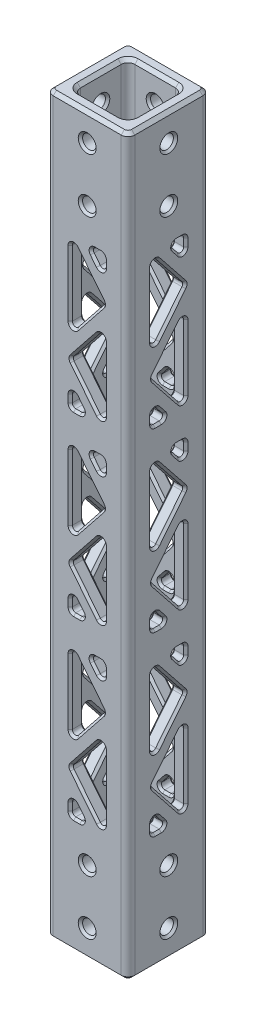
from build123d import *

# Parameters (mm, degrees)
SKETCH1_W                    = 19.05
SKETCH1_H                    = 19.05
SKETCH1_W_2                  = 12.7
SKETCH1_H_2                  = 12.7
BOSS_EXTRUDE1_DEPTH          = 85.725
F_1_8_0_125_DIAMETER_HOLE1_D = 3.175
F_1_8_0_125_DIAMETER_HOLE2_D = 3.175
F_1_8_0_125_DIAMETER_HOLE3_D = 3.175
CUT_EXTRUDE1_REACH           = 88.777
CIRPATTERN1_COUNT            = 4
FILLET1_R                    = 1.5875
FILLET2_R                    = 0.79375
CHAMFER4_SIZE                = 0.762
CHAMFER3_SIZE                = 0.508


with BuildPart() as part:
    # Sketch1 → Boss-Extrude1 (new, symmetric)
    with BuildSketch(Plane(origin=(0, 0, 0), x_dir=(1, 0, 0), z_dir=(0, 1, 0))):
        Rectangle(SKETCH1_W, SKETCH1_H)
        Rectangle(SKETCH1_W_2, SKETCH1_H_2, mode=Mode.SUBTRACT)
    extrude(amount=BOSS_EXTRUDE1_DEPTH, both=True)

    # 1/8 (0.125) Diameter Hole1 (through all)
    with Locations(Plane.ZY.offset(9.525)):
        with Locations((0, 79.375), (0, 66.675)):
            Hole(F_1_8_0_125_DIAMETER_HOLE1_D / 2)

    # 1/8 (0.125) Diameter Hole2 (through all)
    with Locations(Plane.ZY.offset(9.525)):
        with Locations((0, -66.675), (0, -79.375)):
            Hole(F_1_8_0_125_DIAMETER_HOLE2_D / 2)

    # 1/8 (0.125) Diameter Hole3 (through all)
    with Locations(Plane.XY.offset(9.525)):
        with Locations((0, 79.375), (0, 66.675), (0, -66.675), (0, -79.375)):
            Hole(F_1_8_0_125_DIAMETER_HOLE3_D / 2)

    # Sketch14 → Cut-Extrude1 (cut, up to next)
    with BuildSketch(Plane(origin=(0, 0, 0), x_dir=(0, 0, -1), z_dir=(1, 0, 0)), mode=Mode.PRIVATE) as cut_extrude1_sk1:
        Polygon((-3.96875, 53.882145213), (-3.96875, 58.7375), (-0.093532815, 58.7375), align=None)
    cut_extrude1_tool1 = extrude(cut_extrude1_sk1.sketch, amount=-CUT_EXTRUDE1_REACH, mode=Mode.PRIVATE) & part.part
    # Sketch14 → Cut-Extrude1 (cut, up to next)
    with BuildSketch(Plane(origin=(0, 0, 0), x_dir=(0, 0, -1), z_dir=(1, 0, 0)), mode=Mode.PRIVATE) as cut_extrude1_sk2:
        Polygon((3.96875, 58.7375), (-3.96875, 48.792411303), (3.96875, 38.847322606), align=None)
    cut_extrude1_tool2 = extrude(cut_extrude1_sk2.sketch, amount=-CUT_EXTRUDE1_REACH, mode=Mode.PRIVATE) & part.part
    # Sketch14 → Cut-Extrude1 (cut, up to next)
    with BuildSketch(Plane(origin=(0, 0, 0), x_dir=(0, 0, -1), z_dir=(1, 0, 0)), mode=Mode.PRIVATE) as cut_extrude1_sk3:
        Polygon((-3.96875, 43.702677394), (3.96875, 33.757588697), (-3.96875, 23.8125), align=None)
    cut_extrude1_tool3 = extrude(cut_extrude1_sk3.sketch, amount=-CUT_EXTRUDE1_REACH, mode=Mode.PRIVATE) & part.part
    # Sketch14 → Cut-Extrude1 (cut, up to next)
    with BuildSketch(Plane(origin=(0, 0, 0), x_dir=(0, 0, -1), z_dir=(1, 0, 0)), mode=Mode.PRIVATE) as cut_extrude1_sk4:
        Polygon((0.093532815, 23.8125), (3.96875, 23.8125), (3.96875, 28.667854787), align=None)
    cut_extrude1_tool4 = extrude(cut_extrude1_sk4.sketch, amount=-CUT_EXTRUDE1_REACH, mode=Mode.PRIVATE) & part.part
    # Sketch14 → Cut-Extrude1 (cut, up to next)
    with BuildSketch(Plane(origin=(0, 0, 0), x_dir=(0, 0, -1), z_dir=(1, 0, 0)), mode=Mode.PRIVATE) as cut_extrude1_sk5:
        Polygon((-0.093532815, 17.4625), (-3.96875, 17.4625), (-3.96875, 12.607145213), align=None)
    cut_extrude1_tool5 = extrude(cut_extrude1_sk5.sketch, amount=-CUT_EXTRUDE1_REACH, mode=Mode.PRIVATE) & part.part
    # Sketch14 → Cut-Extrude1 (cut, up to next)
    with BuildSketch(Plane(origin=(0, 0, 0), x_dir=(0, 0, -1), z_dir=(1, 0, 0)), mode=Mode.PRIVATE) as cut_extrude1_sk6:
        Polygon((3.96875, 17.4625), (-3.96875, 7.517411303), (3.96875, -2.427677394), align=None)
    cut_extrude1_tool6 = extrude(cut_extrude1_sk6.sketch, amount=-CUT_EXTRUDE1_REACH, mode=Mode.PRIVATE) & part.part
    # Sketch14 → Cut-Extrude1 (cut, up to next)
    with BuildSketch(Plane(origin=(0, 0, 0), x_dir=(0, 0, -1), z_dir=(1, 0, 0)), mode=Mode.PRIVATE) as cut_extrude1_sk7:
        Polygon((-3.96875, -17.4625), (3.96875, -7.517411303), (-3.96875, 2.427677394), align=None)
    cut_extrude1_tool7 = extrude(cut_extrude1_sk7.sketch, amount=-CUT_EXTRUDE1_REACH, mode=Mode.PRIVATE) & part.part
    # Sketch14 → Cut-Extrude1 (cut, up to next)
    with BuildSketch(Plane(origin=(0, 0, 0), x_dir=(0, 0, -1), z_dir=(1, 0, 0)), mode=Mode.PRIVATE) as cut_extrude1_sk8:
        Polygon((0.093532815, -17.4625), (3.96875, -17.4625), (3.96875, -12.607145213), align=None)
    cut_extrude1_tool8 = extrude(cut_extrude1_sk8.sketch, amount=-CUT_EXTRUDE1_REACH, mode=Mode.PRIVATE) & part.part
    # Sketch14 → Cut-Extrude1 (cut, up to next)
    with BuildSketch(Plane(origin=(0, 0, 0), x_dir=(0, 0, -1), z_dir=(1, 0, 0)), mode=Mode.PRIVATE) as cut_extrude1_sk9:
        Polygon((-3.96875, -23.8125), (-0.093532815, -23.8125), (-3.96875, -28.667854787), align=None)
    cut_extrude1_tool9 = extrude(cut_extrude1_sk9.sketch, amount=-CUT_EXTRUDE1_REACH, mode=Mode.PRIVATE) & part.part
    # Sketch14 → Cut-Extrude1 (cut, up to next)
    with BuildSketch(Plane(origin=(0, 0, 0), x_dir=(0, 0, -1), z_dir=(1, 0, 0)), mode=Mode.PRIVATE) as cut_extrude1_sk10:
        Polygon((3.96875, -23.8125), (-3.96875, -33.757588697), (3.96875, -43.702677394), align=None)
    cut_extrude1_tool10 = extrude(cut_extrude1_sk10.sketch, amount=-CUT_EXTRUDE1_REACH, mode=Mode.PRIVATE) & part.part
    # Sketch14 → Cut-Extrude1 (cut, up to next)
    with BuildSketch(Plane(origin=(0, 0, 0), x_dir=(0, 0, -1), z_dir=(1, 0, 0)), mode=Mode.PRIVATE) as cut_extrude1_sk11:
        Polygon((-3.96875, -58.7375), (3.96875, -48.792411303), (-3.96875, -38.847322606), align=None)
    cut_extrude1_tool11 = extrude(cut_extrude1_sk11.sketch, amount=-CUT_EXTRUDE1_REACH, mode=Mode.PRIVATE) & part.part
    # Sketch14 → Cut-Extrude1 (cut, up to next)
    with BuildSketch(Plane(origin=(0, 0, 0), x_dir=(0, 0, -1), z_dir=(1, 0, 0)), mode=Mode.PRIVATE) as cut_extrude1_sk12:
        Polygon((0.093532815, -58.7375), (3.96875, -58.7375), (3.96875, -53.882145213), align=None)
    cut_extrude1_tool12 = extrude(cut_extrude1_sk12.sketch, amount=-CUT_EXTRUDE1_REACH, mode=Mode.PRIVATE) & part.part
    cut_extrude1_1 = cut_extrude1_tool1.solids().sort_by_distance((0, 57.119048, 2.677011))[0]
    add(cut_extrude1_1, mode=Mode.SUBTRACT)
    cut_extrude1_2 = cut_extrude1_tool2.solids().sort_by_distance((0, 48.792411, -1.322917))[0]
    add(cut_extrude1_2, mode=Mode.SUBTRACT)
    cut_extrude1_3 = cut_extrude1_tool3.solids().sort_by_distance((0, 33.757589, 1.322917))[0]
    add(cut_extrude1_3, mode=Mode.SUBTRACT)
    cut_extrude1_4 = cut_extrude1_tool4.solids().sort_by_distance((0, 25.430952, -2.677011))[0]
    add(cut_extrude1_4, mode=Mode.SUBTRACT)
    cut_extrude1_5 = cut_extrude1_tool5.solids().sort_by_distance((0, 15.844048, 2.677011))[0]
    add(cut_extrude1_5, mode=Mode.SUBTRACT)
    cut_extrude1_6 = cut_extrude1_tool6.solids().sort_by_distance((0, 7.517411, -1.322917))[0]
    add(cut_extrude1_6, mode=Mode.SUBTRACT)
    cut_extrude1_7 = cut_extrude1_tool7.solids().sort_by_distance((0, -7.517411, 1.322917))[0]
    add(cut_extrude1_7, mode=Mode.SUBTRACT)
    cut_extrude1_8 = cut_extrude1_tool8.solids().sort_by_distance((0, -15.844048, -2.677011))[0]
    add(cut_extrude1_8, mode=Mode.SUBTRACT)
    cut_extrude1_9 = cut_extrude1_tool9.solids().sort_by_distance((0, -25.430952, 2.677011))[0]
    add(cut_extrude1_9, mode=Mode.SUBTRACT)
    cut_extrude1_10 = cut_extrude1_tool10.solids().sort_by_distance((0, -33.757589, -1.322917))[0]
    add(cut_extrude1_10, mode=Mode.SUBTRACT)
    cut_extrude1_11 = cut_extrude1_tool11.solids().sort_by_distance((0, -48.792411, 1.322917))[0]
    add(cut_extrude1_11, mode=Mode.SUBTRACT)
    cut_extrude1_12 = cut_extrude1_tool12.solids().sort_by_distance((0, -57.119048, -2.677011))[0]
    add(cut_extrude1_12, mode=Mode.SUBTRACT)
    cut_extrude1 = cut_extrude1_1 + cut_extrude1_2 + cut_extrude1_3 + cut_extrude1_4 + cut_extrude1_5 + cut_extrude1_6 + cut_extrude1_7 + cut_extrude1_8 + cut_extrude1_9 + cut_extrude1_10 + cut_extrude1_11 + cut_extrude1_12  # Cut-Extrude1 as one shape, for the pattern or mirror that repeats it

    # CirPattern1: Cut-Extrude1 ×4 about axis
    cirpattern1_axis = Axis((0, 0, 0), (0, 1, 0))
    for i in range(1, CIRPATTERN1_COUNT):
        add(cut_extrude1.rotate(cirpattern1_axis, i * 360 / CIRPATTERN1_COUNT), mode=Mode.SUBTRACT)

    # Fillet1
    fillet1_edges = [part.edges().sort_by_distance(p)[0] for p in [
        (6.35, 0, 6.35),
        (6.35, 0, -6.35),
        (-6.35, 0, -6.35),
        (-6.35, 0, 6.35),
        (9.525, 0, 9.525),
        (-9.525, 0, 9.525),
        (-9.525, 0, -9.525),
        (9.525, 0, -9.525),
    ]]
    fillet(fillet1_edges, radius=FILLET1_R)

    # Fillet2
    fillet2_edges = [part.edges().sort_by_distance(p)[0] for p in [
        (-7.9375, 17.4625, -3.96875),
        (-7.9375, -2.427677394, -3.96875),
        (-7.9375, 7.517411303, 3.96875),
        (-7.9375, 12.607145213, 3.96875),
        (-7.9375, 17.4625, 3.96875),
        (-7.9375, 17.4625, 0.093532815),
        (-7.9375, -12.607145213, -3.96875),
        (-7.9375, -17.4625, -3.96875),
        (-7.9375, -17.4625, -0.093532815),
        (-7.9375, -17.4625, 3.96875),
        (-7.9375, 2.427677394, 3.96875),
        (-7.9375, -7.517411303, -3.96875),
        (-7.9375, 58.7375, -3.96875),
        (-7.9375, 38.847322606, -3.96875),
        (-7.9375, 48.792411303, 3.96875),
        (-7.9375, -58.7375, 3.96875),
        (-7.9375, -38.847322606, 3.96875),
        (-7.9375, -48.792411303, -3.96875),
        (-7.9375, -53.882145213, -3.96875),
        (-7.9375, -58.7375, -3.96875),
        (-7.9375, -58.7375, -0.093532815),
        (-7.9375, 28.667854787, -3.96875),
        (-7.9375, 23.8125, -3.96875),
        (-7.9375, 23.8125, -0.093532815),
        (-7.9375, -23.8125, -3.96875),
        (-7.9375, -43.702677394, -3.96875),
        (-7.9375, -33.757588697, 3.96875),
        (-7.9375, -28.667854787, 3.96875),
        (-7.9375, -23.8125, 3.96875),
        (-7.9375, -23.8125, 0.093532815),
        (-7.9375, 23.8125, 3.96875),
        (-7.9375, 43.702677394, 3.96875),
        (-7.9375, 33.757588697, -3.96875),
        (-7.9375, 58.7375, 3.96875),
        (-7.9375, 58.7375, 0.093532815),
        (-7.9375, 53.882145213, 3.96875),
        (3.96875, 58.7375, 7.9375),
        (0.093532815, 58.7375, 7.9375),
        (3.96875, 53.882145213, 7.9375),
        (7.9375, 23.8125, -3.96875),
        (7.9375, 43.702677394, -3.96875),
        (7.9375, 33.757588697, 3.96875),
        (7.9375, -28.667854787, -3.96875),
        (7.9375, -23.8125, -3.96875),
        (7.9375, -23.8125, -0.093532815),
        (7.9375, -23.8125, 3.96875),
        (7.9375, -43.702677394, 3.96875),
        (7.9375, -33.757588697, -3.96875),
        (7.9375, 17.4625, 3.96875),
        (7.9375, -2.427677394, 3.96875),
        (7.9375, 7.517411303, -3.96875),
        (7.9375, 12.607145213, -3.96875),
        (7.9375, 17.4625, -3.96875),
        (7.9375, 17.4625, -0.093532815),
        (7.9375, -12.607145213, 3.96875),
        (7.9375, -17.4625, 3.96875),
        (7.9375, -17.4625, 0.093532815),
        (7.9375, -17.4625, -3.96875),
        (7.9375, 2.427677394, -3.96875),
        (7.9375, -7.517411303, 3.96875),
        (-3.96875, 17.4625, 7.9375),
        (-3.96875, -2.427677394, 7.9375),
        (3.96875, 7.517411303, 7.9375),
        (3.96875, 12.607145213, 7.9375),
        (3.96875, 17.4625, 7.9375),
        (0.093532815, 17.4625, 7.9375),
        (-3.96875, -12.607145213, 7.9375),
        (-3.96875, -17.4625, 7.9375),
        (-0.093532815, -17.4625, 7.9375),
        (3.96875, -17.4625, 7.9375),
        (3.96875, 2.427677394, 7.9375),
        (-3.96875, -7.517411303, 7.9375),
        (-3.96875, 58.7375, 7.9375),
        (-3.96875, 38.847322606, 7.9375),
        (3.96875, 48.792411303, 7.9375),
        (3.96875, -58.7375, 7.9375),
        (3.96875, -38.847322606, 7.9375),
        (-3.96875, -48.792411303, 7.9375),
        (-3.96875, -53.882145213, 7.9375),
        (-3.96875, -58.7375, 7.9375),
        (-0.093532815, -58.7375, 7.9375),
        (-3.96875, 28.667854787, 7.9375),
        (-3.96875, 23.8125, 7.9375),
        (-0.093532815, 23.8125, 7.9375),
        (3.96875, 17.4625, -7.9375),
        (3.96875, -2.427677394, -7.9375),
        (-3.96875, 7.517411303, -7.9375),
        (-3.96875, 12.607145213, -7.9375),
        (-3.96875, 17.4625, -7.9375),
        (-0.093532815, 17.4625, -7.9375),
        (3.96875, -12.607145213, -7.9375),
        (3.96875, -17.4625, -7.9375),
        (0.093532815, -17.4625, -7.9375),
        (-3.96875, -17.4625, -7.9375),
        (-3.96875, 2.427677394, -7.9375),
        (3.96875, -7.517411303, -7.9375),
        (3.96875, 58.7375, -7.9375),
        (3.96875, 38.847322606, -7.9375),
        (-3.96875, 48.792411303, -7.9375),
        (-3.96875, -58.7375, -7.9375),
        (-3.96875, -38.847322606, -7.9375),
        (3.96875, -48.792411303, -7.9375),
        (3.96875, -53.882145213, -7.9375),
        (3.96875, -58.7375, -7.9375),
        (0.093532815, -58.7375, -7.9375),
        (3.96875, 28.667854787, -7.9375),
        (3.96875, 23.8125, -7.9375),
        (0.093532815, 23.8125, -7.9375),
        (7.9375, 58.7375, 3.96875),
        (7.9375, 38.847322606, 3.96875),
        (7.9375, 48.792411303, -3.96875),
        (7.9375, -58.7375, -3.96875),
        (7.9375, -38.847322606, -3.96875),
        (7.9375, -48.792411303, 3.96875),
        (7.9375, -53.882145213, 3.96875),
        (7.9375, -58.7375, 3.96875),
        (7.9375, -58.7375, 0.093532815),
        (7.9375, 28.667854787, 3.96875),
        (7.9375, 23.8125, 3.96875),
        (7.9375, 23.8125, 0.093532815),
        (7.9375, 58.7375, -3.96875),
        (7.9375, 58.7375, -0.093532815),
        (7.9375, 53.882145213, -3.96875),
        (-3.96875, 23.8125, -7.9375),
        (-3.96875, 43.702677394, -7.9375),
        (3.96875, 33.757588697, -7.9375),
        (-3.96875, -28.667854787, -7.9375),
        (-3.96875, -23.8125, -7.9375),
        (-0.093532815, -23.8125, -7.9375),
        (3.96875, -23.8125, -7.9375),
        (3.96875, -43.702677394, -7.9375),
        (-3.96875, -33.757588697, -7.9375),
        (-3.96875, -23.8125, 7.9375),
        (-3.96875, -43.702677394, 7.9375),
        (3.96875, -33.757588697, 7.9375),
        (3.96875, -28.667854787, 7.9375),
        (3.96875, -23.8125, 7.9375),
        (0.093532815, -23.8125, 7.9375),
        (3.96875, 23.8125, 7.9375),
        (3.96875, 43.702677394, 7.9375),
        (-3.96875, 33.757588697, 7.9375),
        (-3.96875, 58.7375, -7.9375),
        (-0.093532815, 58.7375, -7.9375),
        (-3.96875, 53.882145213, -7.9375),
    ]]
    fillet(fillet2_edges, radius=FILLET2_R)

    # Chamfer4
    chamfer4_edges = [part.edges().sort_by_distance(p)[0] for p in [
        (0, -85.725, -9.525),
        (0, 85.725, -9.525),
        (9.525, -85.725, 0),
        (0, -85.725, 9.525),
        (-9.525, -85.725, 0),
        (0, -85.725, 6.35),
        (6.35, -85.725, 0),
        (0, -85.725, -6.35),
        (-6.35, -85.725, 0),
        (-9.060032015, -85.725, 9.060032015),
        (-9.060032015, -85.725, -9.060032015),
        (9.060032015, -85.725, 9.060032015),
        (9.060032015, -85.725, -9.060032015),
        (9.525, 85.725, 0),
        (-9.525, 85.725, 0),
        (0, 85.725, 9.525),
        (6.35, 85.725, 0),
        (0, 85.725, 6.35),
        (-6.35, 85.725, 0),
        (0, 85.725, -6.35),
        (-9.060032015, 85.725, 9.060032015),
        (-9.060032015, 85.725, -9.060032015),
        (9.060032015, 85.725, 9.060032015),
        (9.060032015, 85.725, -9.060032015),
        (5.885032015, -85.725, -5.885032015),
        (5.885032015, 85.725, -5.885032015),
        (5.885032015, -85.725, 5.885032015),
        (5.885032015, 85.725, 5.885032015),
        (-5.885032015, -85.725, 5.885032015),
        (-5.885032015, 85.725, 5.885032015),
        (-5.885032015, -85.725, -5.885032015),
        (-5.885032015, 85.725, -5.885032015),
    ]]
    chamfer(chamfer4_edges, length=CHAMFER4_SIZE)

    # Chamfer3
    chamfer3_edges = [part.edges().sort_by_distance(p)[0] for p in [
        (-3.43730991, -15.944712226, -6.35),
        (-3.43730991, -15.944712226, -9.525),
        (3.746929296, -7.517411303, -6.35),
        (3.746929296, -7.517411303, -9.525),
        (-3.43730991, 0.909889619, -6.35),
        (-3.43730991, 0.909889619, -9.525),
        (3.43730991, -0.909889619, -6.35),
        (3.43730991, -0.909889619, -9.525),
        (-3.746929296, 7.517411303, -6.35),
        (-3.746929296, 7.517411303, -9.525),
        (3.43730991, 15.944712226, -6.35),
        (3.43730991, 15.944712226, -9.525),
        (-3.43730991, 14.124932987, -6.35),
        (-3.43730991, 14.124932987, -9.525),
        (-3.736266008, 17.230016008, -6.35),
        (-3.736266008, 17.230016008, -9.525),
        (-1.027407916, 17.013001163, -6.35),
        (-1.027407916, 17.013001163, -9.525),
        (1.027407916, 24.261998837, -6.35),
        (1.027407916, 24.261998837, -9.525),
        (3.736266008, 24.044983992, -6.35),
        (3.736266008, 24.044983992, -9.525),
        (3.43730991, 27.150067013, -6.35),
        (3.43730991, 27.150067013, -9.525),
        (-3.43730991, 25.330287774, -6.35),
        (-3.43730991, 25.330287774, -9.525),
        (-3.43730991, 42.184889619, -6.35),
        (-3.43730991, 42.184889619, -9.525),
        (3.746929296, 33.757588697, -6.35),
        (3.746929296, 33.757588697, -9.525),
        (3.43730991, 40.365110381, -6.35),
        (3.43730991, 40.365110381, -9.525),
        (-3.746929296, 48.792411303, -6.35),
        (-3.746929296, 48.792411303, -9.525),
        (3.43730991, 57.219712226, -6.35),
        (3.43730991, 57.219712226, -9.525),
        (-3.43730991, 55.399932987, -6.35),
        (-3.43730991, 55.399932987, -9.525),
        (-1.027407916, 58.288001163, -6.35),
        (-1.027407916, 58.288001163, -9.525),
        (-3.736266008, 58.505016008, -6.35),
        (-3.736266008, 58.505016008, -9.525),
        (6.35, -57.219712226, -3.43730991),
        (9.525, -57.219712226, -3.43730991),
        (6.35, -58.288001163, 1.027407916),
        (9.525, -58.288001163, 1.027407916),
        (6.35, -58.505016008, 3.736266008),
        (9.525, -58.505016008, 3.736266008),
        (6.35, -55.399932987, 3.43730991),
        (9.525, -55.399932987, 3.43730991),
        (6.35, -48.792411303, 3.746929296),
        (9.525, -48.792411303, 3.746929296),
        (6.35, -40.365110381, -3.43730991),
        (9.525, -40.365110381, -3.43730991),
        (6.35, -33.757588697, -3.746929296),
        (9.525, -33.757588697, -3.746929296),
        (6.35, -42.184889619, 3.43730991),
        (9.525, -42.184889619, 3.43730991),
        (6.35, -25.330287774, 3.43730991),
        (9.525, -25.330287774, 3.43730991),
        (6.35, -27.150067013, -3.43730991),
        (9.525, -27.150067013, -3.43730991),
        (6.35, -24.044983992, -3.736266008),
        (9.525, -24.044983992, -3.736266008),
        (6.35, -24.261998837, -1.027407916),
        (9.525, -24.261998837, -1.027407916),
        (6.35, -17.013001163, 1.027407916),
        (9.525, -17.013001163, 1.027407916),
        (6.35, -14.124932987, 3.43730991),
        (9.525, -14.124932987, 3.43730991),
        (6.35, -17.230016008, 3.736266008),
        (9.525, -17.230016008, 3.736266008),
        (6.35, -15.944712226, -3.43730991),
        (9.525, -15.944712226, -3.43730991),
        (6.35, -7.517411303, 3.746929296),
        (9.525, -7.517411303, 3.746929296),
        (6.35, 0.909889619, -3.43730991),
        (9.525, 0.909889619, -3.43730991),
        (6.35, -0.909889619, 3.43730991),
        (9.525, -0.909889619, 3.43730991),
        (6.35, 7.517411303, -3.746929296),
        (9.525, 7.517411303, -3.746929296),
        (6.35, 15.944712226, 3.43730991),
        (9.525, 15.944712226, 3.43730991),
        (6.35, 14.124932987, -3.43730991),
        (9.525, 14.124932987, -3.43730991),
        (6.35, 17.230016008, -3.736266008),
        (9.525, 17.230016008, -3.736266008),
        (6.35, 17.013001163, -1.027407916),
        (9.525, 17.013001163, -1.027407916),
        (6.35, 27.150067013, 3.43730991),
        (9.525, 27.150067013, 3.43730991),
        (6.35, 24.044983992, 3.736266008),
        (9.525, 24.044983992, 3.736266008),
        (6.35, 24.261998837, 1.027407916),
        (9.525, 24.261998837, 1.027407916),
        (6.35, 25.330287774, -3.43730991),
        (9.525, 25.330287774, -3.43730991),
        (6.35, 33.757588697, 3.746929296),
        (9.525, 33.757588697, 3.746929296),
        (6.35, 42.184889619, -3.43730991),
        (9.525, 42.184889619, -3.43730991),
        (6.35, 40.365110381, 3.43730991),
        (9.525, 40.365110381, 3.43730991),
        (6.35, 48.792411303, -3.746929296),
        (9.525, 48.792411303, -3.746929296),
        (6.35, 57.219712226, 3.43730991),
        (9.525, 57.219712226, 3.43730991),
        (6.35, 55.399932987, -3.43730991),
        (9.525, 55.399932987, -3.43730991),
        (6.35, 58.288001163, -1.027407916),
        (9.525, 58.288001163, -1.027407916),
        (6.35, 58.505016008, -3.736266008),
        (9.525, 58.505016008, -3.736266008),
        (-3.43730991, -55.399932987, 6.35),
        (-3.43730991, -55.399932987, 9.525),
        (-1.027407916, -58.288001163, 6.35),
        (-1.027407916, -58.288001163, 9.525),
        (-3.736266008, -58.505016008, 6.35),
        (-3.736266008, -58.505016008, 9.525),
        (3.43730991, -57.219712226, 6.35),
        (3.43730991, -57.219712226, 9.525),
        (3.43730991, -40.365110381, 6.35),
        (3.43730991, -40.365110381, 9.525),
        (-3.746929296, -48.792411303, 6.35),
        (-3.746929296, -48.792411303, 9.525),
        (-3.43730991, -42.184889619, 6.35),
        (-3.43730991, -42.184889619, 9.525),
        (3.746929296, -33.757588697, 6.35),
        (3.746929296, -33.757588697, 9.525),
        (-3.43730991, -25.330287774, 6.35),
        (-3.43730991, -25.330287774, 9.525),
        (3.43730991, -27.150067013, 6.35),
        (3.43730991, -27.150067013, 9.525),
        (3.736266008, -24.044983992, 6.35),
        (3.736266008, -24.044983992, 9.525),
        (1.027407916, -24.261998837, 6.35),
        (1.027407916, -24.261998837, 9.525),
        (-3.736266008, -17.230016008, 6.35),
        (-3.736266008, -17.230016008, 9.525),
        (-3.43730991, -14.124932987, 6.35),
        (-3.43730991, -14.124932987, 9.525),
        (-1.027407916, -17.013001163, 6.35),
        (-1.027407916, -17.013001163, 9.525),
        (3.43730991, -15.944712226, 6.35),
        (3.43730991, -15.944712226, 9.525),
        (3.43730991, 0.909889619, 6.35),
        (3.43730991, 0.909889619, 9.525),
        (-3.746929296, -7.517411303, 6.35),
        (-3.746929296, -7.517411303, 9.525),
        (-3.43730991, -0.909889619, 6.35),
        (-3.43730991, -0.909889619, 9.525),
        (-3.43730991, 15.944712226, 6.35),
        (-3.43730991, 15.944712226, 9.525),
        (3.746929296, 7.517411303, 6.35),
        (3.746929296, 7.517411303, 9.525),
        (3.43730991, 14.124932987, 6.35),
        (3.43730991, 14.124932987, 9.525),
        (1.027407916, 17.013001163, 6.35),
        (1.027407916, 17.013001163, 9.525),
        (3.736266008, 17.230016008, 6.35),
        (3.736266008, 17.230016008, 9.525),
        (-3.736266008, 24.044983992, 6.35),
        (-3.736266008, 24.044983992, 9.525),
        (-3.43730991, 27.150067013, 6.35),
        (-3.43730991, 27.150067013, 9.525),
        (-1.027407916, 24.261998837, 6.35),
        (-1.027407916, 24.261998837, 9.525),
        (3.43730991, 25.330287774, 6.35),
        (3.43730991, 25.330287774, 9.525),
        (3.43730991, 42.184889619, 6.35),
        (3.43730991, 42.184889619, 9.525),
        (-3.746929296, 33.757588697, 6.35),
        (-3.746929296, 33.757588697, 9.525),
        (-3.43730991, 40.365110381, 6.35),
        (-3.43730991, 40.365110381, 9.525),
        (3.746929296, 48.792411303, 6.35),
        (3.746929296, 48.792411303, 9.525),
        (-3.43730991, 57.219712226, 6.35),
        (-3.43730991, 57.219712226, 9.525),
        (3.43730991, 55.399932987, 6.35),
        (3.43730991, 55.399932987, 9.525),
        (1.027407916, 58.288001163, 6.35),
        (1.027407916, 58.288001163, 9.525),
        (3.736266008, 58.505016008, 6.35),
        (3.736266008, 58.505016008, 9.525),
        (6.35, 66.675, 1.5875),
        (-6.35, 66.675, 1.5875),
        (-9.525, 66.675, 1.5875),
        (9.525, 66.675, 1.5875),
        (-6.35, 79.375, 1.5875),
        (6.35, 79.375, 1.5875),
        (9.525, 79.375, 1.5875),
        (-9.525, 79.375, 1.5875),
        (-6.35, -79.375, 1.5875),
        (6.35, -79.375, 1.5875),
        (9.525, -79.375, 1.5875),
        (-9.525, -79.375, 1.5875),
        (6.35, -66.675, 1.5875),
        (-6.35, -66.675, 1.5875),
        (-9.525, -66.675, 1.5875),
        (9.525, -66.675, 1.5875),
        (-9.525, -58.7375, -2.458810655),
        (-6.35, -58.7375, -2.458810655),
        (-9.525, -56.551273789, -1.838431335),
        (-6.35, -56.551273789, -1.838431335),
        (-9.525, -57.04641878, -3.96875),
        (-6.35, -57.04641878, -3.96875),
        (-9.525, -53.126629469, -0.509468968),
        (-6.35, -53.126629469, -0.509468968),
        (-9.525, -48.792411303, 3.96875),
        (-6.35, -48.792411303, 3.96875),
        (-9.525, -44.458193137, -0.509468968),
        (-6.35, -44.458193137, -0.509468968),
        (-9.525, -33.757588697, -3.96875),
        (-6.35, -33.757588697, -3.96875),
        (-9.525, -38.091806863, 0.509468968),
        (-6.35, -38.091806863, 0.509468968),
        (-9.525, -29.423370531, 0.509468968),
        (-6.35, -29.423370531, 0.509468968),
        (-9.525, -25.998726211, 1.838431335),
        (-6.35, -25.998726211, 1.838431335),
        (-9.525, -25.50358122, 3.96875),
        (-6.35, -25.50358122, 3.96875),
        (-9.525, -23.8125, 2.458810655),
        (-6.35, -23.8125, 2.458810655),
        (-9.525, -15.276273789, -1.838431335),
        (-6.35, -15.276273789, -1.838431335),
        (-9.525, -15.77141878, -3.96875),
        (-6.35, -15.77141878, -3.96875),
        (-9.525, -17.4625, -2.458810655),
        (-6.35, -17.4625, -2.458810655),
        (-9.525, -11.851629469, -0.509468968),
        (-6.35, -11.851629469, -0.509468968),
        (-9.525, -7.517411303, 3.96875),
        (-6.35, -7.517411303, 3.96875),
        (-9.525, -3.183193137, -0.509468968),
        (-6.35, -3.183193137, -0.509468968),
        (-9.525, 7.517411303, -3.96875),
        (-6.35, 7.517411303, -3.96875),
        (-9.525, 3.183193137, 0.509468968),
        (-6.35, 3.183193137, 0.509468968),
        (-9.525, 11.851629469, 0.509468968),
        (-6.35, 11.851629469, 0.509468968),
        (-9.525, 15.276273789, 1.838431335),
        (-6.35, 15.276273789, 1.838431335),
        (-9.525, 15.77141878, 3.96875),
        (-6.35, 15.77141878, 3.96875),
        (-9.525, 17.4625, 2.458810655),
        (-6.35, 17.4625, 2.458810655),
        (-9.525, 25.998726211, -1.838431335),
        (-6.35, 25.998726211, -1.838431335),
        (-9.525, 25.50358122, -3.96875),
        (-6.35, 25.50358122, -3.96875),
        (-9.525, 23.8125, -2.458810655),
        (-6.35, 23.8125, -2.458810655),
        (-9.525, 29.423370531, -0.509468968),
        (-6.35, 29.423370531, -0.509468968),
        (-9.525, 33.757588697, 3.96875),
        (-6.35, 33.757588697, 3.96875),
        (-9.525, 38.091806863, -0.509468968),
        (-6.35, 38.091806863, -0.509468968),
        (-9.525, 48.792411303, -3.96875),
        (-6.35, 48.792411303, -3.96875),
        (1.5875, -79.375, -6.35),
        (-9.525, 44.458193137, 0.509468968),
        (1.5875, -79.375, 6.35),
        (-6.35, 44.458193137, 0.509468968),
        (1.5875, -79.375, 9.525),
        (1.5875, -79.375, -9.525),
        (-9.525, 53.126629469, 0.509468968),
        (-6.35, 53.126629469, 0.509468968),
        (-9.525, 56.551273789, 1.838431335),
        (-6.35, 56.551273789, 1.838431335),
        (-9.525, 57.04641878, 3.96875),
        (-6.35, 57.04641878, 3.96875),
        (-9.525, 58.7375, 2.458810655),
        (-6.35, 58.7375, 2.458810655),
        (1.838431335, -56.551273789, -9.525),
        (1.838431335, -56.551273789, -6.35),
        (3.96875, -57.04641878, -9.525),
        (3.96875, -57.04641878, -6.35),
        (2.458810655, -58.7375, -9.525),
        (2.458810655, -58.7375, -6.35),
        (0.509468968, -53.126629469, -9.525),
        (0.509468968, -53.126629469, -6.35),
        (-3.96875, -48.792411303, -9.525),
        (-3.96875, -48.792411303, -6.35),
        (0.509468968, -44.458193137, -9.525),
        (0.509468968, -44.458193137, -6.35),
        (3.96875, -33.757588697, -9.525),
        (3.96875, -33.757588697, -6.35),
        (-0.509468968, -38.091806863, -9.525),
        (-0.509468968, -38.091806863, -6.35),
        (-0.509468968, -29.423370531, -9.525),
        (-0.509468968, -29.423370531, -6.35),
        (-3.96875, -25.50358122, -9.525),
        (-3.96875, -25.50358122, -6.35),
        (-2.458810655, -23.8125, -9.525),
        (-2.458810655, -23.8125, -6.35),
        (-1.838431335, -25.998726211, -9.525),
        (-1.838431335, -25.998726211, -6.35),
        (2.458810655, -17.4625, -9.525),
        (2.458810655, -17.4625, -6.35),
        (1.838431335, -15.276273789, -9.525),
        (1.838431335, -15.276273789, -6.35),
        (3.96875, -15.77141878, -9.525),
        (3.96875, -15.77141878, -6.35),
        (0.509468968, -11.851629469, -9.525),
        (0.509468968, -11.851629469, -6.35),
        (-3.96875, -7.517411303, -9.525),
        (-3.96875, -7.517411303, -6.35),
        (0.509468968, -3.183193137, -9.525),
        (0.509468968, -3.183193137, -6.35),
        (3.96875, 7.517411303, -9.525),
        (3.96875, 7.517411303, -6.35),
        (-0.509468968, 3.183193137, -9.525),
        (-0.509468968, 3.183193137, -6.35),
        (-0.509468968, 11.851629469, -9.525),
        (-0.509468968, 11.851629469, -6.35),
        (-1.838431335, 15.276273789, -9.525),
        (-1.838431335, 15.276273789, -6.35),
        (-3.96875, 15.77141878, -9.525),
        (-3.96875, 15.77141878, -6.35),
        (-2.458810655, 17.4625, -9.525),
        (-2.458810655, 17.4625, -6.35),
        (2.458810655, 23.8125, -9.525),
        (2.458810655, 23.8125, -6.35),
        (1.838431335, 25.998726211, -9.525),
        (1.838431335, 25.998726211, -6.35),
        (3.96875, 25.50358122, -9.525),
        (3.96875, 25.50358122, -6.35),
        (0.509468968, 29.423370531, -9.525),
        (0.509468968, 29.423370531, -6.35),
        (-3.96875, 33.757588697, -9.525),
        (-3.96875, 33.757588697, -6.35),
        (0.509468968, 38.091806863, -9.525),
        (0.509468968, 38.091806863, -6.35),
        (3.96875, 48.792411303, -9.525),
        (3.96875, 48.792411303, -6.35),
        (-0.509468968, 44.458193137, -9.525),
        (-0.509468968, 44.458193137, -6.35),
        (-0.509468968, 53.126629469, -9.525),
        (-0.509468968, 53.126629469, -6.35),
        (-1.838431335, 56.551273789, -9.525),
        (-1.838431335, 56.551273789, -6.35),
        (-3.96875, 57.04641878, -9.525),
        (1.5875, -66.675, 6.35),
        (-3.96875, 57.04641878, -6.35),
        (1.5875, -66.675, -6.35),
        (-2.458810655, 58.7375, -9.525),
        (1.5875, -66.675, -9.525),
        (-2.458810655, 58.7375, -6.35),
        (1.5875, -66.675, 9.525),
        (9.525, -53.126629469, 0.509468968),
        (6.35, -53.126629469, 0.509468968),
        (9.525, -48.792411303, -3.96875),
        (6.35, -48.792411303, -3.96875),
        (9.525, -58.7375, 2.458810655),
        (6.35, -58.7375, 2.458810655),
        (9.525, -56.551273789, 1.838431335),
        (6.35, -56.551273789, 1.838431335),
        (9.525, -57.04641878, 3.96875),
        (6.35, -57.04641878, 3.96875),
        (9.525, -44.458193137, 0.509468968),
        (6.35, -44.458193137, 0.509468968),
        (9.525, -38.091806863, -0.509468968),
        (6.35, -38.091806863, -0.509468968),
        (9.525, -29.423370531, -0.509468968),
        (6.35, -29.423370531, -0.509468968),
        (9.525, -33.757588697, 3.96875),
        (6.35, -33.757588697, 3.96875),
        (9.525, -25.998726211, -1.838431335),
        (6.35, -25.998726211, -1.838431335),
        (9.525, -25.50358122, -3.96875),
        (6.35, -25.50358122, -3.96875),
        (9.525, -23.8125, -2.458810655),
        (6.35, -23.8125, -2.458810655),
        (9.525, -17.4625, 2.458810655),
        (6.35, -17.4625, 2.458810655),
        (9.525, -15.276273789, 1.838431335),
        (6.35, -15.276273789, 1.838431335),
        (9.525, -15.77141878, 3.96875),
        (6.35, -15.77141878, 3.96875),
        (9.525, -11.851629469, 0.509468968),
        (6.35, -11.851629469, 0.509468968),
        (9.525, -7.517411303, -3.96875),
        (6.35, -7.517411303, -3.96875),
        (9.525, -3.183193137, 0.509468968),
        (6.35, -3.183193137, 0.509468968),
        (9.525, 7.517411303, 3.96875),
        (6.35, 7.517411303, 3.96875),
        (9.525, 3.183193137, -0.509468968),
        (6.35, 3.183193137, -0.509468968),
        (9.525, 11.851629469, -0.509468968),
        (6.35, 11.851629469, -0.509468968),
        (9.525, 15.276273789, -1.838431335),
        (6.35, 15.276273789, -1.838431335),
        (9.525, 15.77141878, -3.96875),
        (6.35, 15.77141878, -3.96875),
        (9.525, 17.4625, -2.458810655),
        (6.35, 17.4625, -2.458810655),
        (9.525, 25.998726211, 1.838431335),
        (6.35, 25.998726211, 1.838431335),
        (9.525, 25.50358122, 3.96875),
        (6.35, 25.50358122, 3.96875),
        (9.525, 23.8125, 2.458810655),
        (6.35, 23.8125, 2.458810655),
        (9.525, 29.423370531, 0.509468968),
        (6.35, 29.423370531, 0.509468968),
        (9.525, 33.757588697, -3.96875),
        (6.35, 33.757588697, -3.96875),
        (9.525, 38.091806863, 0.509468968),
        (6.35, 38.091806863, 0.509468968),
        (9.525, 48.792411303, 3.96875),
        (6.35, 48.792411303, 3.96875),
        (9.525, 44.458193137, -0.509468968),
        (6.35, 44.458193137, -0.509468968),
        (9.525, 53.126629469, -0.509468968),
        (6.35, 53.126629469, -0.509468968),
        (9.525, 56.551273789, -1.838431335),
        (6.35, 56.551273789, -1.838431335),
        (9.525, 57.04641878, -3.96875),
        (6.35, 57.04641878, -3.96875),
        (9.525, 58.7375, -2.458810655),
        (6.35, 58.7375, -2.458810655),
        (-1.838431335, -56.551273789, 9.525),
        (-1.838431335, -56.551273789, 6.35),
        (1.5875, 66.675, -6.35),
        (-3.96875, -57.04641878, 9.525),
        (1.5875, 66.675, 6.35),
        (-3.96875, -57.04641878, 6.35),
        (1.5875, 66.675, 9.525),
        (-2.458810655, -58.7375, 9.525),
        (1.5875, 66.675, -9.525),
        (-2.458810655, -58.7375, 6.35),
        (-0.509468968, -53.126629469, 9.525),
        (-0.509468968, -53.126629469, 6.35),
        (3.96875, -48.792411303, 9.525),
        (3.96875, -48.792411303, 6.35),
        (-0.509468968, -44.458193137, 9.525),
        (-0.509468968, -44.458193137, 6.35),
        (-3.96875, -33.757588697, 9.525),
        (-3.96875, -33.757588697, 6.35),
        (0.509468968, -38.091806863, 9.525),
        (0.509468968, -38.091806863, 6.35),
        (0.509468968, -29.423370531, 9.525),
        (0.509468968, -29.423370531, 6.35),
        (1.838431335, -25.998726211, 9.525),
        (1.838431335, -25.998726211, 6.35),
        (3.96875, -25.50358122, 9.525),
        (3.96875, -25.50358122, 6.35),
        (2.458810655, -23.8125, 9.525),
        (2.458810655, -23.8125, 6.35),
        (-3.96875, -15.77141878, 9.525),
        (-3.96875, -15.77141878, 6.35),
        (-2.458810655, -17.4625, 9.525),
        (-2.458810655, -17.4625, 6.35),
        (-1.838431335, -15.276273789, 9.525),
        (-1.838431335, -15.276273789, 6.35),
        (-0.509468968, -11.851629469, 9.525),
        (-0.509468968, -11.851629469, 6.35),
        (3.96875, -7.517411303, 9.525),
        (3.96875, -7.517411303, 6.35),
        (-0.509468968, -3.183193137, 9.525),
        (-0.509468968, -3.183193137, 6.35),
        (-3.96875, 7.517411303, 9.525),
        (-3.96875, 7.517411303, 6.35),
        (0.509468968, 3.183193137, 9.525),
        (0.509468968, 3.183193137, 6.35),
        (0.509468968, 11.851629469, 9.525),
        (0.509468968, 11.851629469, 6.35),
        (1.838431335, 15.276273789, 9.525),
        (1.838431335, 15.276273789, 6.35),
        (3.96875, 15.77141878, 9.525),
        (3.96875, 15.77141878, 6.35),
        (2.458810655, 17.4625, 9.525),
        (2.458810655, 17.4625, 6.35),
        (-3.96875, 25.50358122, 9.525),
        (-3.96875, 25.50358122, 6.35),
        (-2.458810655, 23.8125, 9.525),
        (-2.458810655, 23.8125, 6.35),
        (-1.838431335, 25.998726211, 9.525),
        (-1.838431335, 25.998726211, 6.35),
        (-0.509468968, 29.423370531, 9.525),
        (-0.509468968, 29.423370531, 6.35),
        (3.96875, 33.757588697, 9.525),
        (3.96875, 33.757588697, 6.35),
        (-0.509468968, 38.091806863, 9.525),
        (-0.509468968, 38.091806863, 6.35),
        (-3.96875, 48.792411303, 9.525),
        (-3.96875, 48.792411303, 6.35),
        (0.509468968, 44.458193137, 9.525),
        (0.509468968, 44.458193137, 6.35),
        (0.509468968, 53.126629469, 9.525),
        (0.509468968, 53.126629469, 6.35),
        (1.838431335, 56.551273789, 9.525),
        (1.838431335, 56.551273789, 6.35),
        (3.96875, 57.04641878, 9.525),
        (3.96875, 57.04641878, 6.35),
        (2.458810655, 58.7375, 9.525),
        (2.458810655, 58.7375, 6.35),
        (-6.35, -58.288001163, -1.027407916),
        (-9.525, -58.288001163, -1.027407916),
        (-6.35, -55.399932987, -3.43730991),
        (-9.525, -55.399932987, -3.43730991),
        (-6.35, -58.505016008, -3.736266008),
        (-9.525, -58.505016008, -3.736266008),
        (-6.35, -57.219712226, 3.43730991),
        (-9.525, -57.219712226, 3.43730991),
        (-6.35, -40.365110381, 3.43730991),
        (-9.525, -40.365110381, 3.43730991),
        (-6.35, -48.792411303, -3.746929296),
        (-9.525, -48.792411303, -3.746929296),
        (-6.35, -42.184889619, -3.43730991),
        (-9.525, -42.184889619, -3.43730991),
        (-6.35, -33.757588697, 3.746929296),
        (-9.525, -33.757588697, 3.746929296),
        (-6.35, -25.330287774, -3.43730991),
        (-9.525, -25.330287774, -3.43730991),
        (-6.35, -27.150067013, 3.43730991),
        (-9.525, -27.150067013, 3.43730991),
        (-6.35, -24.044983992, 3.736266008),
        (-9.525, -24.044983992, 3.736266008),
        (-6.35, -24.261998837, 1.027407916),
        (-9.525, -24.261998837, 1.027407916),
        (1.5875, 79.375, 6.35),
        (-6.35, -14.124932987, -3.43730991),
        (-9.525, -14.124932987, -3.43730991),
        (-6.35, -17.230016008, -3.736266008),
        (1.5875, 79.375, -6.35),
        (-9.525, -17.230016008, -3.736266008),
        (-6.35, -17.013001163, -1.027407916),
        (1.5875, 79.375, -9.525),
        (-9.525, -17.013001163, -1.027407916),
        (-6.35, -15.944712226, 3.43730991),
        (-9.525, -15.944712226, 3.43730991),
        (1.5875, 79.375, 9.525),
        (-6.35, -7.517411303, -3.746929296),
        (-9.525, -7.517411303, -3.746929296),
        (-6.35, 0.909889619, 3.43730991),
        (-9.525, 0.909889619, 3.43730991),
        (-6.35, -0.909889619, -3.43730991),
        (-9.525, -0.909889619, -3.43730991),
        (-6.35, 7.517411303, 3.746929296),
        (-9.525, 7.517411303, 3.746929296),
        (-6.35, 15.944712226, -3.43730991),
        (-9.525, 15.944712226, -3.43730991),
        (-6.35, 14.124932987, 3.43730991),
        (-9.525, 14.124932987, 3.43730991),
        (-6.35, 17.230016008, 3.736266008),
        (-9.525, 17.230016008, 3.736266008),
        (-6.35, 17.013001163, 1.027407916),
        (-9.525, 17.013001163, 1.027407916),
        (-6.35, 27.150067013, -3.43730991),
        (-9.525, 27.150067013, -3.43730991),
        (-6.35, 24.044983992, -3.736266008),
        (-9.525, 24.044983992, -3.736266008),
        (-6.35, 24.261998837, -1.027407916),
        (-9.525, 24.261998837, -1.027407916),
        (-6.35, 25.330287774, 3.43730991),
        (-9.525, 25.330287774, 3.43730991),
        (-6.35, 42.184889619, 3.43730991),
        (-9.525, 42.184889619, 3.43730991),
        (-6.35, 33.757588697, -3.746929296),
        (-9.525, 33.757588697, -3.746929296),
        (-6.35, 40.365110381, -3.43730991),
        (-9.525, 40.365110381, -3.43730991),
        (-6.35, 48.792411303, 3.746929296),
        (-9.525, 48.792411303, 3.746929296),
        (-6.35, 57.219712226, -3.43730991),
        (-9.525, 57.219712226, -3.43730991),
        (-6.35, 55.399932987, 3.43730991),
        (-9.525, 55.399932987, 3.43730991),
        (-6.35, 58.288001163, 1.027407916),
        (-9.525, 58.288001163, 1.027407916),
        (-6.35, 58.505016008, 3.736266008),
        (-9.525, 58.505016008, 3.736266008),
        (3.43730991, -55.399932987, -6.35),
        (3.43730991, -55.399932987, -9.525),
        (3.736266008, -58.505016008, -6.35),
        (3.736266008, -58.505016008, -9.525),
        (1.027407916, -58.288001163, -6.35),
        (1.027407916, -58.288001163, -9.525),
        (-3.43730991, -57.219712226, -6.35),
        (-3.43730991, -57.219712226, -9.525),
        (-3.43730991, -40.365110381, -6.35),
        (-3.43730991, -40.365110381, -9.525),
        (3.746929296, -48.792411303, -6.35),
        (3.746929296, -48.792411303, -9.525),
        (3.43730991, -42.184889619, -6.35),
        (3.43730991, -42.184889619, -9.525),
        (-3.746929296, -33.757588697, -6.35),
        (-3.746929296, -33.757588697, -9.525),
        (-3.736266008, -24.044983992, -6.35),
        (-3.736266008, -24.044983992, -9.525),
        (-3.43730991, -27.150067013, -6.35),
        (-3.43730991, -27.150067013, -9.525),
        (-1.027407916, -24.261998837, -6.35),
        (-1.027407916, -24.261998837, -9.525),
        (3.43730991, -25.330287774, -6.35),
        (3.43730991, -25.330287774, -9.525),
        (1.027407916, -17.013001163, -6.35),
        (1.027407916, -17.013001163, -9.525),
        (3.43730991, -14.124932987, -6.35),
        (3.43730991, -14.124932987, -9.525),
        (3.736266008, -17.230016008, -6.35),
        (3.736266008, -17.230016008, -9.525),
    ]]
    chamfer(chamfer3_edges, length=CHAMFER3_SIZE)


solid = part.part
